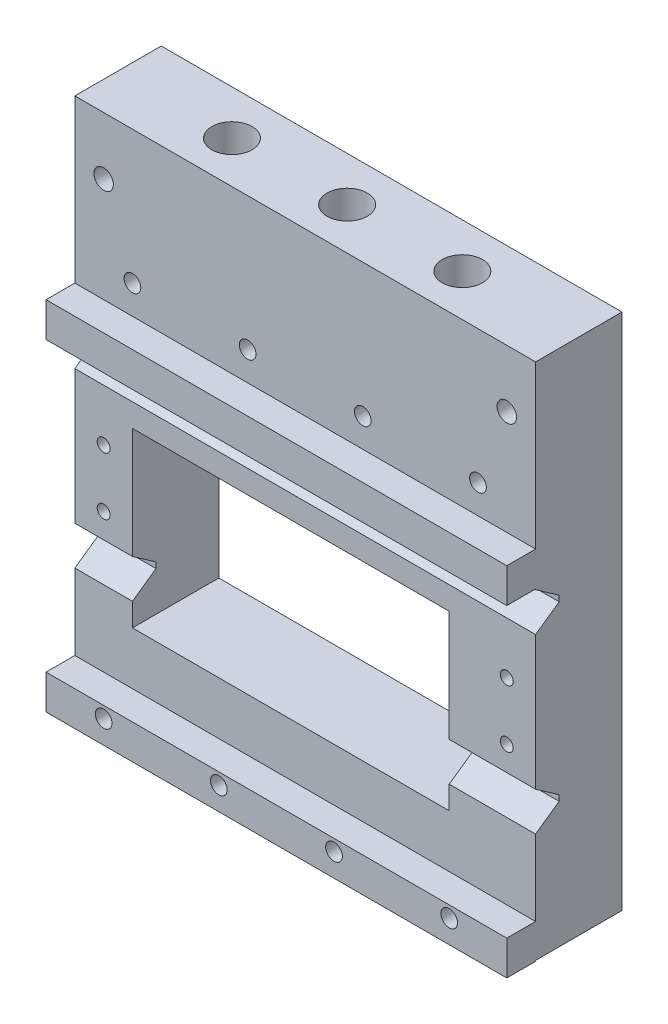
from build123d import *

# Parameters (mm, degrees)
SKETCH1_W            = 160
SKETCH1_H            = 180
SKETCH1_W_2          = 110
SKETCH1_H_2          = 60
BOSS_EXTRUDE1_DEPTH  = 30
CUT_EXTRUDE1_DEPTH   = 300
SKETCH11_W           = 160
SKETCH11_H           = 12
BOSS_EXTRUDE2_DEPTH  = 10
SKETCH3_R            = 3
CUT_EXTRUDE2_DEPTH   = 100
SKETCH4_R            = 7
CUT_EXTRUDE3_DEPTH   = 70
LPATTERN1_COUNT      = 3
LPATTERN1_PITCH      = 40
SKETCH5_R            = 2.238650571
CUT_EXTRUDE4_DEPTH   = 100
SKETCH6_R            = 4.368973
CUT_EXTRUDE5_DEPTH   = 25
LPATTERN2_COUNT      = 2
LPATTERN2_PITCH      = 20
LPATTERN2_COUNT_DIR2 = 2
LPATTERN2_PITCH_DIR2 = 140
SKETCH9_R            = 3.381759822
CUT_EXTRUDE8_DEPTH   = 100
CUT_EXTRUDE9_START   = -10
SKETCH10_R           = 6.982534733
CUT_EXTRUDE9_DEPTH   = 20
LPATTERN4_COUNT      = 2
LPATTERN4_PITCH      = 140
LPATTERN5_COUNT      = 2
LPATTERN5_PITCH      = 112
LPATTERN6_COUNT      = 2
LPATTERN6_PITCH      = 60
SKETCH7_R            = 2.900161541
CUT_EXTRUDE6_DEPTH   = 40
SKETCH8_R            = 5.870976625
CUT_EXTRUDE7_DEPTH   = 25
LPATTERN3_COUNT      = 4
LPATTERN3_PITCH      = 40
LPATTERN3_COUNT_DIR2 = 2
LPATTERN3_PITCH_DIR2 = 126


with BuildPart() as part:
    # Sketch1 → Boss-Extrude1 (new body)
    with BuildSketch(Plane.XY):
        with Locations((-3.103448276, 46.293103448)):
            Rectangle(SKETCH1_W, SKETCH1_H)
        with Locations((-8.103448276, 16.293103448)):
            Rectangle(SKETCH1_W_2, SKETCH1_H_2, mode=Mode.SUBTRACT)
    extrude(amount=BOSS_EXTRUDE1_DEPTH)

    # Sketch2 → Cut-Extrude1 (cut)
    with BuildSketch(Plane.ZY.offset(83.103448276)):
        Polygon((30, 7.764632175), (21.808479557, 2.028867812), (21.808479557, 0.028867812), (30, -5.706896552), align=None)
    cut_extrude1 = extrude(amount=-CUT_EXTRUDE1_DEPTH, mode=Mode.SUBTRACT)

    # Sketch11 → Boss-Extrude2 (add)
    with BuildSketch(Plane.XY.offset(30)):
        with Locations((-3.103448276, -38.001295945)):
            Rectangle(SKETCH11_W, SKETCH11_H)
    boss_extrude2 = extrude(amount=BOSS_EXTRUDE2_DEPTH)

    # Sketch3 → Cut-Extrude2 (cut)
    with BuildSketch(Plane(origin=(0, 136.293103448, 0), x_dir=(1, 0, 0), z_dir=(0, 1, 0))):
        with Locations((-43.103448276, -15.436210525)):
            Circle(SKETCH3_R)
    cut_extrude2 = extrude(amount=-CUT_EXTRUDE2_DEPTH, mode=Mode.SUBTRACT)

    # Sketch4 → Cut-Extrude3 (cut)
    with BuildSketch(Plane(origin=(0, 136.293103448, 0), x_dir=(1, 0, 0), z_dir=(0, 1, 0))):
        with Locations((-43.103448276, -15.436210525)):
            Circle(SKETCH4_R)
    cut_extrude3 = extrude(amount=-CUT_EXTRUDE3_DEPTH, mode=Mode.SUBTRACT)

    # LPattern1: Cut-Extrude2, Cut-Extrude3 ×3
    with Locations(*[(i * LPATTERN1_PITCH, 0, 0) for i in range(1, LPATTERN1_COUNT)]):
        add(cut_extrude2, mode=Mode.SUBTRACT)
        add(cut_extrude3, mode=Mode.SUBTRACT)

    # Sketch5 → Cut-Extrude4 (cut)
    with BuildSketch(Plane(origin=(0, 0, 0), x_dir=(-1, 0, 0), z_dir=(0, 0, -1))):
        with Locations((73.103448276, 16.293103448)):
            Circle(SKETCH5_R)
    cut_extrude4 = extrude(amount=-CUT_EXTRUDE4_DEPTH, mode=Mode.SUBTRACT)

    # Sketch6 → Cut-Extrude5 (cut)
    with BuildSketch(Plane(origin=(0, 0, 0), x_dir=(-1, 0, 0), z_dir=(0, 0, -1))):
        with Locations((73.103448276, 16.293103448)):
            Circle(SKETCH6_R)
    cut_extrude5 = extrude(amount=-CUT_EXTRUDE5_DEPTH, mode=Mode.SUBTRACT)

    # LPattern2: Cut-Extrude4, Cut-Extrude5 2 × 2
    with Locations(*[(j * LPATTERN2_PITCH_DIR2, i * LPATTERN2_PITCH, 0) for i in range(LPATTERN2_COUNT) for j in range(LPATTERN2_COUNT_DIR2) if (i, j) != (0, 0)]):
        add(cut_extrude4, mode=Mode.SUBTRACT)
        add(cut_extrude5, mode=Mode.SUBTRACT)

    # Sketch9 → Cut-Extrude8 (cut)
    with BuildSketch(Plane(origin=(0, 0, 0), x_dir=(-1, 0, 0), z_dir=(0, 0, -1))):
        with Locations((-66.896551724, 116.293103448)):
            Circle(SKETCH9_R)
    cut_extrude8 = extrude(amount=-CUT_EXTRUDE8_DEPTH, mode=Mode.SUBTRACT)

    # Sketch10 → Cut-Extrude9 (cut)
    with BuildSketch(Plane.XY.offset(30).offset(CUT_EXTRUDE9_START)):
        with Locations((66.896551724, 116.293103448)):
            Circle(SKETCH10_R)
    cut_extrude9 = extrude(amount=-CUT_EXTRUDE9_DEPTH, mode=Mode.SUBTRACT)

    # LPattern4: Cut-Extrude8, Cut-Extrude9 ×2
    with Locations(*[(-i * LPATTERN4_PITCH, 0, 0) for i in range(1, LPATTERN4_COUNT)]):
        add(cut_extrude8, mode=Mode.SUBTRACT)
        add(cut_extrude9, mode=Mode.SUBTRACT)

    # LPattern5: Boss-Extrude2 ×2
    with Locations(*[(0, i * LPATTERN5_PITCH, 0) for i in range(1, LPATTERN5_COUNT)]):
        add(boss_extrude2)

    # LPattern6: Cut-Extrude1 ×2
    with Locations(*[(0, i * LPATTERN6_PITCH, 0) for i in range(1, LPATTERN6_COUNT)]):
        add(cut_extrude1, mode=Mode.SUBTRACT)

    # Sketch7 → Cut-Extrude6 (cut)
    with BuildSketch(Plane(origin=(0, 0, 0), x_dir=(-1, 0, 0), z_dir=(0, 0, -1))):
        with Locations((63.103448276, 89.998704055)):
            Circle(SKETCH7_R)
    cut_extrude6 = extrude(amount=-CUT_EXTRUDE6_DEPTH, mode=Mode.SUBTRACT)

    # Sketch8 → Cut-Extrude7 (cut)
    with BuildSketch(Plane(origin=(0, 0, 0), x_dir=(-1, 0, 0), z_dir=(0, 0, -1))):
        with Locations((63.103448276, 89.998704055)):
            Circle(SKETCH8_R)
    cut_extrude7 = extrude(amount=-CUT_EXTRUDE7_DEPTH, mode=Mode.SUBTRACT)

    # LPattern3: Cut-Extrude6, Cut-Extrude7 4 × 2
    with Locations(*[(i * LPATTERN3_PITCH, -j * LPATTERN3_PITCH_DIR2, 0) for i in range(LPATTERN3_COUNT) for j in range(LPATTERN3_COUNT_DIR2) if (i, j) != (0, 0)]):
        add(cut_extrude6, mode=Mode.SUBTRACT)
        add(cut_extrude7, mode=Mode.SUBTRACT)


solid = part.part
